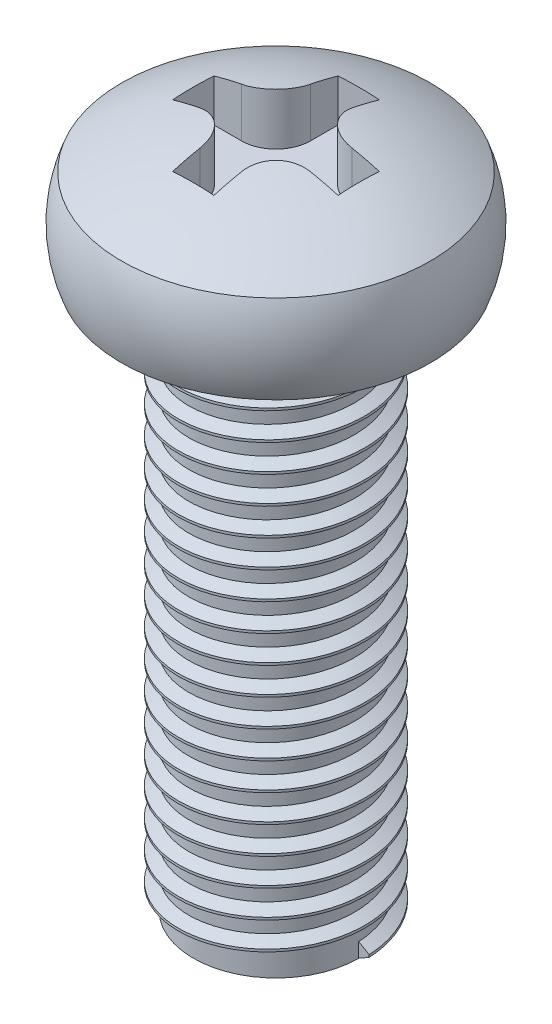
from build123d import *

# Parameters (mm, degrees)
SKETCH1_W           = 2.8
SKETCH1_H           = 1.6
SKETCH2_W           = 0.75
SKETCH2_H           = 0.75
CUT_EXTRUDE1_DEPTH  = 1
SKETCH3_R           = 1.5
BOSS_EXTRUDE1_DEPTH = 10
THREAD1_PITCH       = 0.5


with BuildPart() as part:
    # Sketch1 → Revolve1 (revolve)
    with BuildSketch(Plane.XY, mode=Mode.PRIVATE) as revolve1_sk:
        with BuildLine():
            Line((0, 1.6), (2.8, 1.6))
            ThreePointArc((2.8, 1.6), (1.456021978, 2.196076922), (0, 2.4))
            Line((0, 2.4), (0, 1.6))
        make_face()
        with Locations((1.4, 0.8)):
            Rectangle(SKETCH1_W, SKETCH1_H)
        with BuildLine():
            ThreePointArc((2.8, 1.6), (2.95, 0.8), (2.8, 0))
            Line((2.8, 0), (2.8, 1.6))
        make_face()
    revolve(revolve1_sk.sketch.rotate(Axis((0, 2.4, 0), (0, -1, 0)), 180), axis=Axis((0, 2.4, 0), (0, -1, 0)))

    # Sketch2 → Cut-Extrude1 (cut)
    with BuildSketch(Plane(origin=(0, 2.4, 0), x_dir=(1, 0, 0), z_dir=(0, 1, 0))):
        Polygon((-0.375, 0.375), (0.375, 0.375), (0.375, 1), (0.375, 1.5), (-0.375, 1.5), (-0.375, 1), align=None)
        with BuildLine():
            Line((-1, 0.375), (-0.375, 0.375))
            Line((-0.375, 0.375), (-0.375, 1))
            ThreePointArc((-0.375, 1), (-0.558058262, 0.558058262), (-1, 0.375))
        make_face()
        Polygon((-1, -0.375), (-0.375, -0.375), (-0.375, 0.375), (-1, 0.375), (-1.5, 0.375), (-1.5, -0.375), align=None)
        Rectangle(SKETCH2_W, SKETCH2_H)
        Polygon((-0.375, -1.5), (0.375, -1.5), (0.375, -1), (0.375, -0.375), (-0.375, -0.375), (-0.375, -1), align=None)
        Polygon((0.375, 0.375), (0.375, -0.375), (1, -0.375), (1.5, -0.375), (1.5, 0.375), (1, 0.375), align=None)
        with BuildLine():
            Line((0.375, 1), (0.375, 0.375))
            Line((0.375, 0.375), (1, 0.375))
            ThreePointArc((1, 0.375), (0.558058262, 0.558058262), (0.375, 1))
        make_face()
        with BuildLine():
            Line((0.375, -0.375), (0.375, -1))
            ThreePointArc((0.375, -1), (0.558058262, -0.558058262), (1, -0.375))
            Line((1, -0.375), (0.375, -0.375))
        make_face()
        with BuildLine():
            ThreePointArc((-1, -0.375), (-0.558058262, -0.558058262), (-0.375, -1))
            Line((-0.375, -1), (-0.375, -0.375))
            Line((-0.375, -0.375), (-1, -0.375))
        make_face()
    extrude(amount=-CUT_EXTRUDE1_DEPTH, mode=Mode.SUBTRACT)

    # Sketch3 → Boss-Extrude1 (add)
    with BuildSketch(Plane.XZ):
        Circle(SKETCH3_R)
    extrude(amount=BOSS_EXTRUDE1_DEPTH)

    # Thread1: arcs per turn and ends read off the stored shape
    # Thread1: the profile of Thread Profile1 profile screwed along a right-hand helix through 20 turns, 6 arcs to a turn; built about Z, then put on its axis
    thread1_z = Axis((0, 0, 0), (0, 0, 1))
    thread1_corners = [(1.4997, 0, -10.000173205), (1.689443056, 0, -9.890625), (1.689443056, 0, -9.846875), (1.4997, 0, -9.737326796)]
    with BuildLine(mode=Mode.PRIVATE) as thread1_profile:
        Line(thread1_corners[0], thread1_corners[1])
        Line(thread1_corners[1], thread1_corners[2])
        Line(thread1_corners[2], thread1_corners[3])
        Line(thread1_corners[3], thread1_corners[0])
    thread1_cap = Face(thread1_profile.wire())
    thread1_turn_angles = [0, 30, 60, 90, 120, 150, 180, 210, 240, 270, 300, 330, 360]
    thread1_turn_weights = [1, 0.8660254037844387, 1, 0.8660254037844387, 1, 0.8660254037844387, 1, 0.8660254037844387, 1, 0.8660254037844387, 1, 0.8660254037844387, 1]
    thread1_turn_rails = [Edge.make_bspline([Vector(p[0], p[1], 0).rotate(thread1_z, thread1_turn_angles[k]) / thread1_turn_weights[k] + Vector(0, 0, p[2] + THREAD1_PITCH * thread1_turn_angles[k] / 360) for k in range(13)], [0, 0, 0, 1, 1, 2, 2, 3, 3, 4, 4, 5, 5, 6, 6, 6], 2, thread1_turn_weights) for p in thread1_corners]
    thread1_turn_sides = [Face.make_surface_from_curves(thread1_turn_rails[p[0]], thread1_turn_rails[p[1]]) for p in [(0, 1), (1, 2), (2, 3), (3, 0)]]
    thread1 = Plane(origin=(0, 0, 0), x_dir=(1, 0, 0), z_dir=(0, 1, 0)) * Solid(Shell([*[p.moved(Location((0, 0, THREAD1_PITCH * i))) for i in range(20) for p in thread1_turn_sides], thread1_cap, thread1_cap.rotate(thread1_z, 7200).moved(Location((0, 0, THREAD1_PITCH * 7200 / 360)))]))
    add(thread1)


solid = part.part
